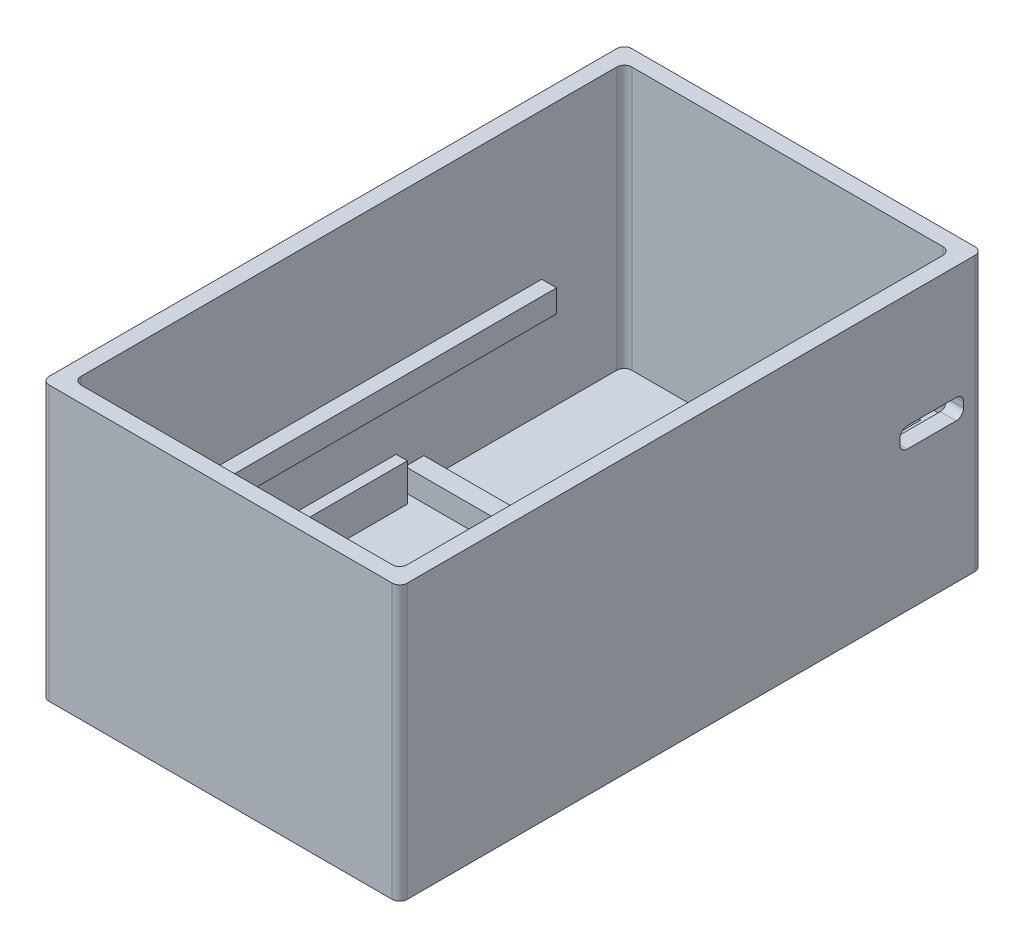
from build123d import *

# Parameters (mm, degrees)
PCB_DIMENSIONS_W    = 47.716732244
PCB_DIMENSIONS_H    = 77.636732244
BOSS_EXTRUDE3_DEPTH = 1.5
SKETCH5_W           = 47.716732244
SKETCH5_H           = 77.636732244
SKETCH5_W_2         = 43.474091557
SKETCH5_H_2         = 73.394091557
BOSS_EXTRUDE5_DEPTH = 35
FILLET1_R           = 1
SKETCH9_W           = 1.93805105
SKETCH9_H           = 42
SKETCH9_W_2         = 1.938051049
BOSS_EXTRUDE6_DEPTH = 5
SKETCH14_W          = 15
SKETCH14_H          = 2.5
BOSS_EXTRUDE7_DEPTH = 3
SKETCH15_W          = 75.636732244
SKETCH15_H          = 3
BOSS_EXTRUDE8_DEPTH = 46
SKETCH17_W          = 39.522771214
SKETCH17_H          = 62.982276128
CUT_EXTRUDE1_DEPTH  = 3
CUT_EXTRUDE2_DEPTH  = 3
SKETCH19_W          = 8.5
SKETCH19_H          = 2.7
CUT_EXTRUDE3_DEPTH  = 3
FILLET2_R           = 1


with BuildPart() as part:
    # PCB Dimensions → Boss-Extrude3 (new body)
    with BuildSketch(Plane(origin=(0, 0, 0), x_dir=(1, 0, 0), z_dir=(0, 1, 0))):
        with Locations((20.322832216, -35.282832216)):
            Rectangle(PCB_DIMENSIONS_W, PCB_DIMENSIONS_H)
    extrude(amount=BOSS_EXTRUDE3_DEPTH)

    # Sketch5 → Boss-Extrude5 (add)
    with BuildSketch(Plane(origin=(0, 1.5, 0), x_dir=(1, 0, 0), z_dir=(0, 1, 0))):
        with Locations((20.322832216, -35.282832216)):
            Rectangle(SKETCH5_W, SKETCH5_H)
        with Locations((20.322832217, -35.282832217)):
            Rectangle(SKETCH5_W_2, SKETCH5_H_2, mode=Mode.SUBTRACT)
    extrude(amount=BOSS_EXTRUDE5_DEPTH)

    # Fillet1
    fillet1_edges = [part.edges().sort_by_distance(p)[0] for p in [
        (42.059877995, 19, 71.979877995),
        (-3.535533906, 18.25, 74.101198338),
        (44.181198338, 18.25, 74.101198338),
        (44.181198338, 18.25, -3.535533906),
        (-3.535533906, 18.25, -3.535533906),
        (-1.414213562, 19, 71.979877995),
        (42.059877995, 19, -1.414213562),
        (-1.414213562, 19, -1.414213562),
    ]]
    fillet(fillet1_edges, radius=FILLET1_R)

    # Sketch9 → Boss-Extrude6 (add)
    with BuildSketch(Plane(origin=(0, 1.5, 0), x_dir=(1, 0, 0), z_dir=(0, 1, 0))):
        with Locations((-0.88911969, -49.979881394)):
            Rectangle(SKETCH9_W, SKETCH9_H)
        with Locations((41.534784122, -49.979881394)):
            Rectangle(SKETCH9_W_2, SKETCH9_H)
    extrude(amount=BOSS_EXTRUDE6_DEPTH)

    # Sketch14 → Boss-Extrude7 (add)
    with BuildSketch(Plane(origin=(0, 1.5, 0), x_dir=(1, 0, 0), z_dir=(0, 1, 0))):
        with Locations((6.085786438, -26.529881394)):
            Rectangle(SKETCH14_W, SKETCH14_H)
        with Locations((34.559877995, -26.529881394)):
            Rectangle(SKETCH14_W, SKETCH14_H)
    extrude(amount=BOSS_EXTRUDE7_DEPTH)

    # Sketch15 → Boss-Extrude8 (add)
    with BuildSketch(Plane(origin=(44.181198338, 0, 0), x_dir=(0, 0, -1), z_dir=(1, 0, 0))):
        with Locations((-35.282832216, 15.5)):
            Rectangle(SKETCH15_W, SKETCH15_H)
    extrude(amount=-BOSS_EXTRUDE8_DEPTH)

    # Sketch17 → Cut-Extrude1 (cut)
    with BuildSketch(Plane(origin=(0, 17, 0), x_dir=(1, 0, 0), z_dir=(0, 1, 0))):
        with Locations((20.322832216, -32.052584673)):
            Rectangle(SKETCH17_W, SKETCH17_H)
    extrude(amount=-CUT_EXTRUDE1_DEPTH, mode=Mode.SUBTRACT)

    # Sketch18 → Cut-Extrude2 (cut)
    with BuildSketch(Plane(origin=(0, 17, 0), x_dir=(1, 0, 0), z_dir=(0, 1, 0))):
        with BuildLine():
            Line((-1.414213562, -9.585786438), (28.585786438, -9.585786438))
            Line((28.585786438, -9.585786438), (28.585786438, 1.414213562))
            Line((28.585786438, 1.414213562), (-0.414213562, 1.414213562))
            ThreePointArc((-0.414213562, 1.414213562), (-1.121320344, 1.121320344), (-1.414213562, 0.414213562))
            Line((-1.414213562, 0.414213562), (-1.414213562, -9.585786438))
        make_face()
    extrude(amount=-CUT_EXTRUDE2_DEPTH, mode=Mode.SUBTRACT)

    # Sketch19 → Cut-Extrude3 (cut)
    with BuildSketch(Plane(origin=(44.181198338, 0, 0), x_dir=(0, 0, -1), z_dir=(1, 0, 0))):
        with Locations((-3.214466094, 20)):
            Rectangle(SKETCH19_W, SKETCH19_H)
    extrude(amount=-CUT_EXTRUDE3_DEPTH, mode=Mode.SUBTRACT)

    # Fillet2
    fillet2_edges = [part.edges().sort_by_distance(p)[0] for p in [
        (43.012316494, 21.35, -1.035533906),
    ]]
    fillet(fillet2_edges, radius=FILLET2_R)
    fillet2_2_edges = [part.edges().sort_by_distance(p)[0] for p in [
        (43.120538167, 18.65, 7.464466094),
    ]]
    fillet(fillet2_2_edges, radius=FILLET2_R)
    fillet2_3_edges = [part.edges().sort_by_distance(p)[0] for p in [
        (43.120538167, 21.35, 7.464466094),
    ]]
    fillet(fillet2_3_edges, radius=FILLET2_R)
    fillet2_4_edges = [part.edges().sort_by_distance(p)[0] for p in [
        (43.012316494, 18.65, -1.035533906),
    ]]
    fillet(fillet2_4_edges, radius=FILLET2_R)


solid = part.part
